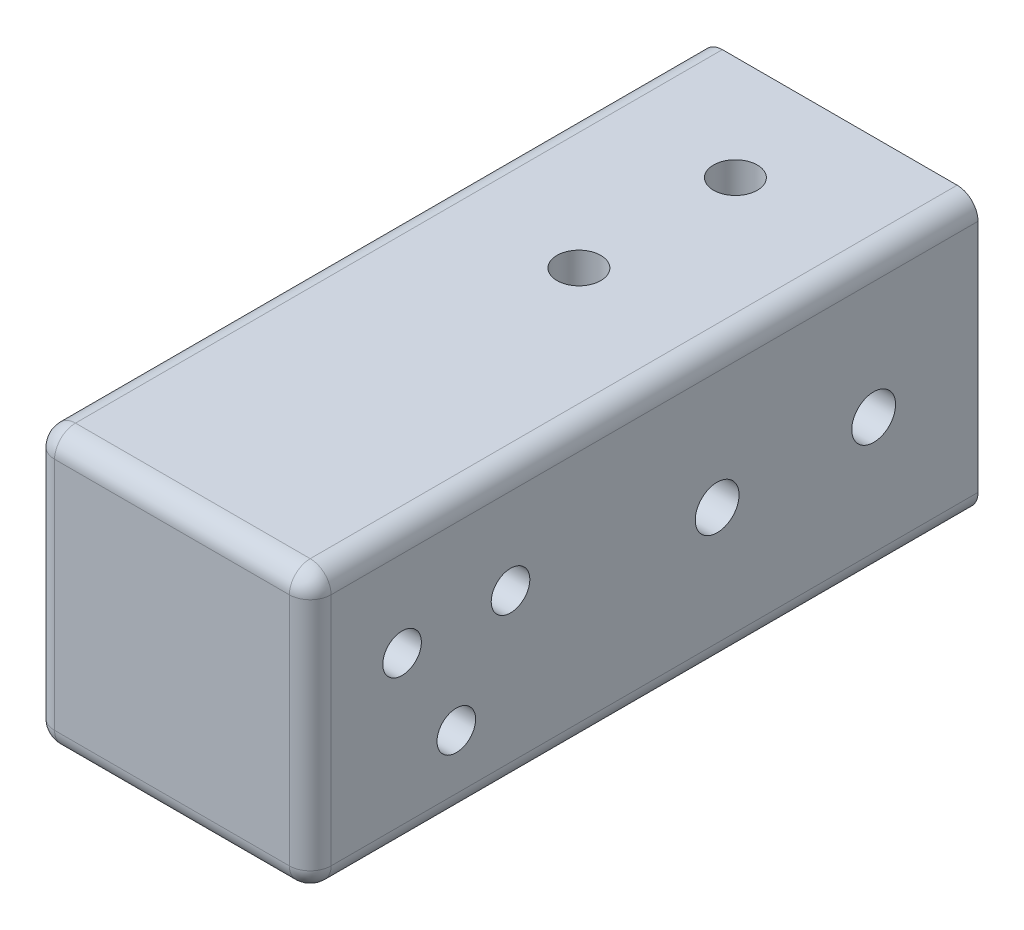
from build123d import *

# Parameters (mm, degrees)
SKETCH_1_W           = 26.5
SKETCH_1_H           = 26.5
SKETCH_1_W_2         = 20.5
SKETCH_1_H_2         = 20.5
EXTRUDE_1_DEPTH      = 40
SKETCH_3_W           = 26.5
SKETCH_3_H           = 26.5
EXTRUDE_2_DEPTH      = 20
SKETCH_9_W           = 26.5
SKETCH_9_H           = 26.5
EXTRUDE_5_DEPTH      = 4
SKETCH_10_R          = 12
SKETCH_10_R_2        = 10
EXTRUDE_7_DEPTH      = 4
EXTRUDE_START        = 4
SKETCH_12_R          = 12
SKETCH_12_R_2        = 10
EXTRUDE_8_DEPTH      = 4
SKETCH_13_R          = 1.85
CUT_EXTRUDE_3_DEPTH  = 73.123591841
SKETCH_15_R          = 2.1
CUT_EXTRUDE_5_DEPTH  = 73.123591841
SKETCH_14_R          = 2.1
CUT_EXTRUDE_6_DEPTH  = 72.384959901
SKETCH_18_R          = 12
CUT_EXTRUDE_9_DEPTH  = 4
CUT_EXTRUDE_START    = 4
SKETCH_19_R          = 12
CUT_EXTRUDE_11_DEPTH = 4
FILLET_6_R           = 2
FILLET_7_R           = 2
FILLET_8_R           = 2
FILLET_9_R           = 2


with BuildPart() as part:
    # 草图1 → 凸台-拉伸1 (new body)
    with BuildSketch(Plane.XY):
        Rectangle(SKETCH_1_W, SKETCH_1_H)
        Rectangle(SKETCH_1_W_2, SKETCH_1_H_2, mode=Mode.SUBTRACT)
    extrude(amount=EXTRUDE_1_DEPTH)

    # 草图3 → 凸台-拉伸2 (add)
    with BuildSketch(Plane.XY.offset(40)):
        Rectangle(SKETCH_3_W, SKETCH_3_H)
    extrude(amount=EXTRUDE_2_DEPTH)

    # 草图9 → 凸台-拉伸5 (add)
    with BuildSketch(Plane.XY.offset(60)):
        Rectangle(SKETCH_9_W, SKETCH_9_H)
    extrude(amount=EXTRUDE_5_DEPTH)

    # 草图10 → 凸台-拉伸7 (add)
    with BuildSketch(Plane(origin=(13.25, 0, 0), x_dir=(0, 0, -1), z_dir=(1, 0, 0))):
        with Locations(Location((-50, 0, 0), (0, 0, 180))):
            Circle(SKETCH_10_R)
        with Locations((-50, 0)):
            Circle(SKETCH_10_R_2, mode=Mode.SUBTRACT)
    extrude(amount=EXTRUDE_7_DEPTH)

    # 草图12 → 凸台-拉伸8 (add)
    with BuildSketch(Plane.ZY.offset(13.25).offset(EXTRUDE_START)):
        with Locations((50, 0)):
            Circle(SKETCH_12_R)
        with Locations(Location((50, 0, 0), (0, 0, 180))):
            Circle(SKETCH_12_R_2, mode=Mode.SUBTRACT)
    extrude(amount=-EXTRUDE_8_DEPTH)

    # 草图13 → 切除-拉伸3 (cut, through all)
    with BuildSketch(Plane.ZY.offset(13.25)):
        with Locations((55.196152423, 3)):
            Circle(SKETCH_13_R)
        with Locations((50, -6)):
            Circle(SKETCH_13_R)
        with Locations((44.803847577, 3)):
            Circle(SKETCH_13_R)
    extrude(amount=-CUT_EXTRUDE_3_DEPTH, mode=Mode.SUBTRACT)

    # 草图15 → 切除-拉伸5 (cut, through all)
    with BuildSketch(Plane(origin=(13.25, 0, 0), x_dir=(0, 0, -1), z_dir=(1, 0, 0))):
        with Locations((-10, 0)):
            Circle(SKETCH_15_R)
        with Locations((-25, 0)):
            Circle(SKETCH_15_R)
    extrude(amount=-CUT_EXTRUDE_5_DEPTH, mode=Mode.SUBTRACT)

    # 草图14 → 切除-拉伸6 (cut, through all)
    with BuildSketch(Plane.XZ.offset(13.25)):
        with Locations(Location((0, 10, 0), (0, 0, 270))):
            Circle(SKETCH_14_R)
        with Locations(Location((0, 25, 0), (0, 0, 270))):
            Circle(SKETCH_14_R)
    extrude(amount=-CUT_EXTRUDE_6_DEPTH, mode=Mode.SUBTRACT)

    # 草图18 → 切除-拉伸9 (cut)
    with BuildSketch(Plane(origin=(13.25, 0, 0), x_dir=(0, 0, -1), z_dir=(1, 0, 0))):
        with Locations((-50, 0)):
            Circle(SKETCH_18_R)
    extrude(amount=CUT_EXTRUDE_9_DEPTH, mode=Mode.SUBTRACT)

    # 草图19 → 切除-拉伸11 (cut)
    with BuildSketch(Plane.ZY.offset(13.25).offset(CUT_EXTRUDE_START)):
        with Locations((50, 0)):
            Circle(SKETCH_19_R)
    extrude(amount=-CUT_EXTRUDE_11_DEPTH, mode=Mode.SUBTRACT)

    # 圆角6
    fillet_6_edges = [part.edges().sort_by_distance(p)[0] for p in [
        (0, -13.25, 64),
        (13.25, -13.25, 32),
        (-13.25, -13.25, 32),
    ]]
    fillet(fillet_6_edges, radius=FILLET_6_R)

    # 圆角7
    # the kernel refuses this fillet: 2 mm, written as the material it takes off along each edge
    with BuildSketch(Plane(origin=(11.25, -11.25, 62), x_dir=(1, 0, 0), z_dir=(0, 0, 1))) as fillet_7_piece_1_section:
        Polygon((0, 0), (FILLET_7_R, 0), (FILLET_7_R, -FILLET_7_R), (0, -FILLET_7_R), align=None)
    fillet_7_piece_1 = extrude(amount=FILLET_7_R, mode=Mode.PRIVATE)
    fillet_7_piece_1 = fillet_7_piece_1 - Plane(origin=(11.25, -11.25, 62), x_dir=(-0.7071067811865475, 0.7071067811865475, 0), z_dir=(0, 0, 1)) * Sphere(FILLET_7_R, mode=Mode.PRIVATE)
    add(fillet_7_piece_1, mode=Mode.SUBTRACT)
    with BuildSketch(Plane(origin=(13.25, 18.25, 64), x_dir=(-1, 0, 0), z_dir=(0, -1, 0))) as fillet_7_piece_2:
        with BuildLine():
            CenterArc((FILLET_7_R, FILLET_7_R), FILLET_7_R, 180, 90)
            Line((0, FILLET_7_R), (0, 0))
            Line((0, 0), (FILLET_7_R, 0))
        make_face()
    extrude(amount=29.5, mode=Mode.SUBTRACT)
    with BuildSketch(Plane(origin=(13.25, 13.25, 69), x_dir=(-1, 0, 0), z_dir=(0, 0, -1))) as fillet_7_piece_3:
        with BuildLine():
            CenterArc((FILLET_7_R, -FILLET_7_R), FILLET_7_R, 90, 90)
            Line((0, -FILLET_7_R), (0, 0))
            Line((0, 0), (FILLET_7_R, 0))
        make_face()
    extrude(amount=74, mode=Mode.SUBTRACT)

    # 圆角8
    # the kernel refuses this fillet: 2 mm, written as the material it takes off along each edge
    with BuildSketch(Plane(origin=(11.25, 11.25, 62), x_dir=(0, 1, 0), z_dir=(0, 0, 1))) as fillet_8_piece_1_section:
        Polygon((0, 0), (FILLET_8_R, 0), (FILLET_8_R, -FILLET_8_R), (0, -FILLET_8_R), align=None)
    fillet_8_piece_1 = extrude(amount=FILLET_8_R, mode=Mode.PRIVATE)
    fillet_8_piece_1 = fillet_8_piece_1 - Plane(origin=(11.25, 11.25, 62), x_dir=(-0.7071067811865475, -0.7071067811865475, 0), z_dir=(0, 0, 1)) * Sphere(FILLET_8_R, mode=Mode.PRIVATE)
    add(fillet_8_piece_1, mode=Mode.SUBTRACT)
    with BuildSketch(Plane(origin=(-18.25, 13.25, 64), x_dir=(0, -1, 0), z_dir=(1, 0, 0))) as fillet_8_piece_2:
        with BuildLine():
            CenterArc((FILLET_8_R, FILLET_8_R), FILLET_8_R, 180, 90)
            Line((0, FILLET_8_R), (0, 0))
            Line((0, 0), (FILLET_8_R, 0))
        make_face()
    extrude(amount=29.5, mode=Mode.SUBTRACT)
    with BuildSketch(Plane(origin=(-13.25, 13.25, -5), x_dir=(0, -1, 0), z_dir=(0, 0, 1))) as fillet_8_piece_3:
        with BuildLine():
            CenterArc((FILLET_8_R, FILLET_8_R), FILLET_8_R, 180, 90)
            Line((0, FILLET_8_R), (0, 0))
            Line((0, 0), (FILLET_8_R, 0))
        make_face()
    extrude(amount=74, mode=Mode.SUBTRACT)

    # 圆角9
    # the kernel refuses this fillet: 2 mm, written as the material it takes off along each edge
    with BuildSketch(Plane(origin=(-11.25, -11.25, 62), x_dir=(0, 0, 1), z_dir=(-1, 0, 0))) as fillet_9_piece_1_section:
        Polygon((0, 0), (FILLET_9_R, 0), (FILLET_9_R, -FILLET_9_R), (0, -FILLET_9_R), align=None)
    fillet_9_piece_1 = extrude(amount=FILLET_9_R, mode=Mode.PRIVATE)
    fillet_9_piece_1 = fillet_9_piece_1 - Plane(origin=(-11.25, -11.25, 62), x_dir=(0, 0.7071067811865475, -0.7071067811865475), z_dir=(-1, 0, 0)) * Sphere(FILLET_9_R, mode=Mode.PRIVATE)
    add(fillet_9_piece_1, mode=Mode.SUBTRACT)
    with BuildSketch(Plane(origin=(-11.25, 11.25, 62), x_dir=(0, 0, 1), z_dir=(-1, 0, 0))) as fillet_9_piece_2_section:
        Polygon((0, 0), (FILLET_9_R, 0), (FILLET_9_R, FILLET_9_R), (0, FILLET_9_R), align=None)
    fillet_9_piece_2 = extrude(amount=FILLET_9_R, mode=Mode.PRIVATE)
    fillet_9_piece_2 = fillet_9_piece_2 - Plane(origin=(-11.25, 11.25, 62), x_dir=(0, -0.7071067811865475, -0.7071067811865475), z_dir=(-1, 0, 0)) * Sphere(FILLET_9_R, mode=Mode.PRIVATE)
    add(fillet_9_piece_2, mode=Mode.SUBTRACT)
    with BuildSketch(Plane(origin=(-13.25, -11.25, 64), x_dir=(0, 0, -1), z_dir=(0, 1, 0))) as fillet_9_piece_3:
        with BuildLine():
            CenterArc((FILLET_9_R, -FILLET_9_R), FILLET_9_R, 90, 90)
            Line((0, -FILLET_9_R), (0, 0))
            Line((0, 0), (FILLET_9_R, 0))
        make_face()
    extrude(amount=22.5, mode=Mode.SUBTRACT)


solid = part.part
